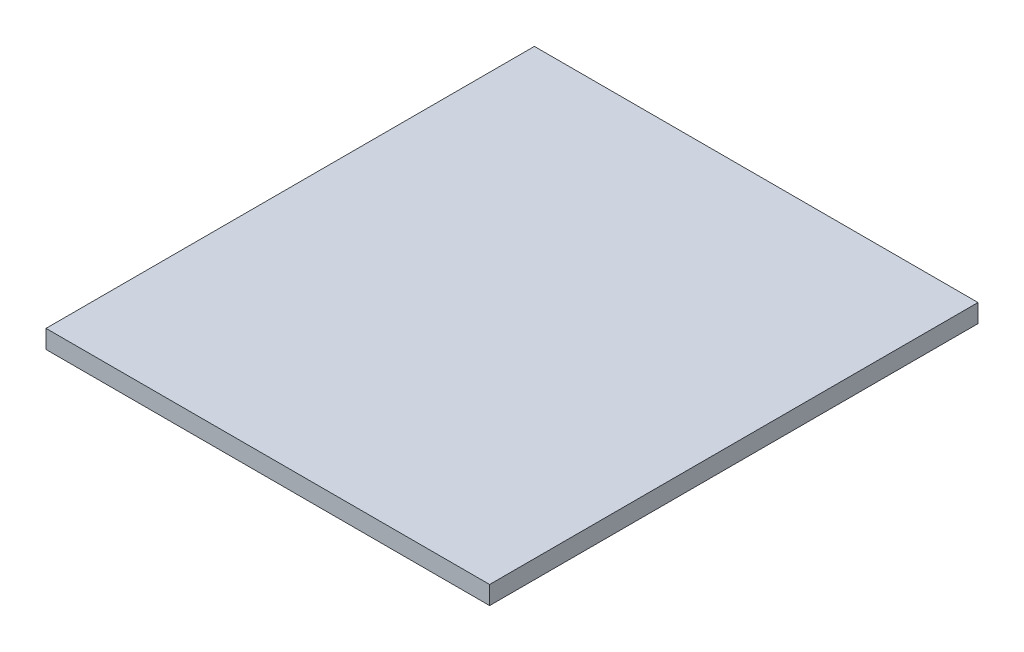
from build123d import *

# Parameters (mm, degrees)
SKETCH1_W           = 218
SKETCH1_H           = 240
BOSS_EXTRUDE1_DEPTH = 9


with BuildPart() as part:
    # Sketch1 → Boss-Extrude1 (new body)
    with BuildSketch(Plane(origin=(0, 0, 0), x_dir=(1, 0, 0), z_dir=(0, 1, 0))):
        Rectangle(SKETCH1_W, SKETCH1_H)
    extrude(amount=BOSS_EXTRUDE1_DEPTH)


solid = part.part
